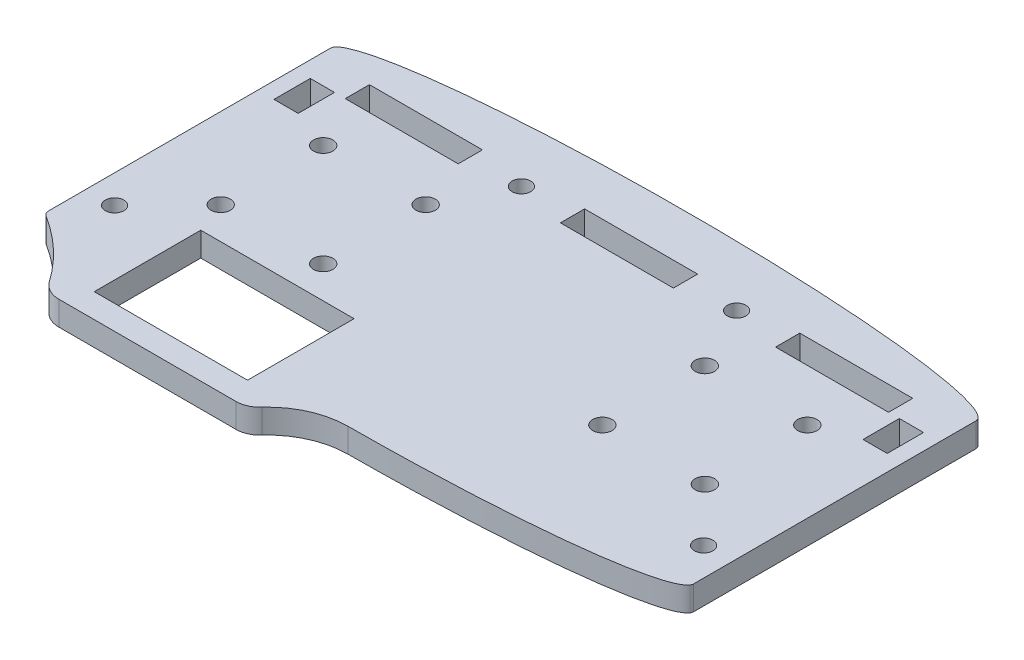
from build123d import *

# Parameters (mm, degrees)
SKETCH1_W           = 80
SKETCH1_H           = 35
BOSS_EXTRUDE1_DEPTH = 1.5
SKETCH2_R           = 1.15
SKETCH2_W           = 14
SKETCH2_H           = 3
CUT_EXTRUDE1_DEPTH  = 44.763569324
BOSS_EXTRUDE2_DEPTH = 3
SKETCH5_R           = 1.2
CUT_EXTRUDE2_DEPTH  = 46.749317077
SKETCH7_R           = 1.15
SKETCH7_W           = 3
SKETCH7_H           = 4.5
CUT_EXTRUDE3_DEPTH  = 46.749317077
BOSS_EXTRUDE3_DEPTH = 3
BOSS_EXTRUDE4_DEPTH = 3
CUT_EXTRUDE4_DEPTH  = 10
FILLET1_START       = -1.5
FILLET1_DEPTH       = 3
FILLET2_START       = -1.5
FILLET2_DEPTH       = 3
FILLET3_R           = 3


with BuildPart() as part:
    # Sketch1 → Boss-Extrude1 (new, symmetric)
    with BuildSketch(Plane(origin=(0, 0, 0), x_dir=(1, 0, 0), z_dir=(0, 1, 0))):
        Rectangle(SKETCH1_W, SKETCH1_H)
    extrude(amount=BOSS_EXTRUDE1_DEPTH, both=True)

    # Sketch2 → Cut-Extrude1 (cut, through all)
    with BuildSketch(Plane(origin=(0, 1.5, 0), x_dir=(1, 0, 0), z_dir=(0, 1, 0))):
        with Locations(Location((-13.333333333, 14.5, 0), (0, 0, 270))):
            Circle(SKETCH2_R)
        with Locations(Location((13.333333333, 14.5, 0), (0, 0, 270))):
            Circle(SKETCH2_R)
        with Locations((-26.666666667, 14.5)):
            Rectangle(SKETCH2_W, SKETCH2_H)
        with Locations((0, 14.5)):
            Rectangle(SKETCH2_W, SKETCH2_H)
        with Locations((26.666666667, 14.5)):
            Rectangle(SKETCH2_W, SKETCH2_H)
    extrude(amount=-CUT_EXTRUDE1_DEPTH, mode=Mode.SUBTRACT)

    # Sketch3 → Boss-Extrude2 (add)
    with BuildSketch(Plane(origin=(0, 1.5, 0), x_dir=(1, 0, 0), z_dir=(0, 1, 0))):
        with BuildLine():
            Line((40, 17.5), (-40, 17.5))
            add(Edge.make_bspline(
                [(40, 17.5), (40, 22), (0, 22), (-40, 22), (-40, 17.5)],
                knots=[3.141592654, 3.141592654, 3.141592654, 4.71238898, 4.71238898, 6.283185307, 6.283185307, 6.283185307], degree=2, weights=[1, 0.707106781, 1, 0.707106781, 1]))
        make_face()
    extrude(amount=-BOSS_EXTRUDE2_DEPTH)

    # Sketch5 → Cut-Extrude2 (cut, through all)
    with BuildSketch(Plane.XZ.offset(1.5)):
        with Locations(Location((17.3, -6.6, 0), (0, 0, 270))):
            Circle(SKETCH5_R)
        with Locations(Location((17.3, 6.1, 0), (0, 0, 270))):
            Circle(SKETCH5_R)
        with Locations(Location((30, 6.1, 0), (0, 0, 270))):
            Circle(SKETCH5_R)
        with Locations(Location((30, -6.6, 0), (0, 0, 270))):
            Circle(SKETCH5_R)
        with Locations(Location((-17.3, 6.1, 0), (0, 0, 270))):
            Circle(SKETCH5_R)
        with Locations(Location((-30, -6.6, 0), (0, 0, 270))):
            Circle(SKETCH5_R)
        with Locations(Location((-30, 6.1, 0), (0, 0, 270))):
            Circle(SKETCH5_R)
        with Locations(Location((-17.3, -6.6, 0), (0, 0, 270))):
            Circle(SKETCH5_R)
    extrude(amount=-CUT_EXTRUDE2_DEPTH, mode=Mode.SUBTRACT)

    # Sketch7 → Cut-Extrude3 (cut, through all)
    with BuildSketch(Plane.XZ.offset(1.5)):
        with Locations(Location((-36.5, 12.75, 0), (0, 0, 270))):
            Circle(SKETCH7_R)
        with Locations(Location((36.5, 12.75, 0), (0, 0, 270))):
            Circle(SKETCH7_R)
        with Locations((36.5, -10.75)):
            Rectangle(SKETCH7_W, SKETCH7_H)
        with Locations((-36.5, -10.75)):
            Rectangle(SKETCH7_W, SKETCH7_H)
    extrude(amount=-CUT_EXTRUDE3_DEPTH, mode=Mode.SUBTRACT)

    # Sketch8 → Boss-Extrude3 (add)
    with BuildSketch(Plane.XZ.offset(1.5)):
        with BuildLine():
            Line((-40, 17.5), (40, 17.5))
            add(Edge.make_bspline(
                [(40, 17.5), (40, 22), (0, 22), (-40, 22), (-40, 17.5)],
                knots=[0, 0, 0, 1.570796327, 1.570796327, 3.141592654, 3.141592654, 3.141592654], degree=2, weights=[1, 0.707106781, 1, 0.707106781, 1]))
        make_face()
    extrude(amount=-BOSS_EXTRUDE3_DEPTH)

    # Sketch10 → Boss-Extrude4 (add)
    with BuildSketch(Plane(origin=(0, 1.5, 0), x_dir=(1, 0, 0), z_dir=(0, 1, 0))):
        with BuildLine():
            add(Edge.make_bspline(
                [(-31.5, -20.273415933), (-30.097145276, -20.475072928), (-28.5, -20.657524495)],
                knots=[3.805646931, 3.805646931, 3.805646931, 3.920888088, 3.920888088, 3.920888088], degree=2, weights=[1, 0.989412299, 0.982106666]))
            Line((-31.5, -20.273415933), (-31.5, -26.273415933))
            Line((-31.5, -26.273415933), (-6.5, -26.273415933))
            Line((-6.5, -26.273415933), (-6.5, -21.940188446))
            add(Edge.make_bspline(
                [(-9.5, -21.871243923), (-8.01173666, -21.912179734), (-6.5, -21.940188446)],
                knots=[4.471327399, 4.471327399, 4.471327399, 4.549165177, 4.549165177, 4.549165177], degree=2, weights=[0.987194732, 0.992848708, 1]))
            Line((-9.5, -21.871243923), (-9.5, -23.273415933))
            Line((-9.5, -23.273415933), (-28.5, -23.273415933))
            Line((-28.5, -23.273415933), (-28.5, -20.657524495))
        make_face()
        with BuildLine():
            add(Edge.make_bspline(
                [(-28.5, -20.657524495), (-20.531503418, -21.567814066), (-9.5, -21.871243923)],
                knots=[3.920888088, 3.920888088, 3.920888088, 4.471327399, 4.471327399, 4.471327399], degree=2, weights=[0.982106666, 0.94721195, 0.987194732]))
            Line((-28.5, -20.657524495), (-28.5, -23.273415933))
            Line((-28.5, -23.273415933), (-9.5, -23.273415933))
            Line((-9.5, -23.273415933), (-9.5, -21.871243923))
        make_face()
    extrude(amount=-BOSS_EXTRUDE4_DEPTH)

    # Sketch10<3> → Cut-Extrude4 (cut)
    with BuildSketch(Plane(origin=(0, 1.5, 0), x_dir=(1, 0, 0), z_dir=(0, 1, 0))):
        with BuildLine():
            Line((-28.5, -10.073415933), (-28.5, -20.657524495))
            add(Edge.make_bspline(
                [(-28.5, -20.657524495), (-20.531503418, -21.567814066), (-9.5, -21.871243923)],
                knots=[3.920888088, 3.920888088, 3.920888088, 4.471327399, 4.471327399, 4.471327399], degree=2, weights=[0.982106666, 0.94721195, 0.987194732]))
            Line((-9.5, -21.871243923), (-9.5, -10.073415933))
            Line((-9.5, -10.073415933), (-28.5, -10.073415933))
        make_face()
        with BuildLine():
            add(Edge.make_bspline(
                [(-28.5, -20.657524495), (-20.531503418, -21.567814066), (-9.5, -21.871243923)],
                knots=[3.920888088, 3.920888088, 3.920888088, 4.471327399, 4.471327399, 4.471327399], degree=2, weights=[0.982106666, 0.94721195, 0.987194732]))
            Line((-28.5, -20.657524495), (-28.5, -23.273415933))
            Line((-28.5, -23.273415933), (-9.5, -23.273415933))
            Line((-9.5, -23.273415933), (-9.5, -21.871243923))
        make_face()
    extrude(amount=-CUT_EXTRUDE4_DEPTH, mode=Mode.SUBTRACT)

    # Fillet1: read off the stored shape, not the designer's step
    # Fillet1 outline → Fillet1 (add)
    with BuildSketch(Plane(origin=(0, 0, 0), x_dir=(1, 0, 0), z_dir=(0, 1, 0)).offset(FILLET1_START)):
        with BuildLine():
            add(Edge.make_bspline(
                [(-31.5, -20.273415933), (-37.645057381, -19.390078703), (-39.385725394, -18.285606399)],
                knots=[2.477538376, 2.477538376, 2.477538376, 2.964990982, 2.964990982, 2.964990982], degree=2, weights=[1, 0.95990848, 0.978675751]))
            ThreePointArc((-39.385725394, -18.285606399), (-34.988771161, -21.831222917), (-31.5, -26.273415933))
            Line((-31.5, -26.273415933), (-31.5, -20.273415933))
        make_face()
    extrude(amount=FILLET1_DEPTH)

    # Fillet2: read off the stored shape, not the designer's step
    # Fillet2 outline → Fillet2 (add)
    with BuildSketch(Plane(origin=(0, 0, 0), x_dir=(1, 0, 0), z_dir=(0, 1, 0)).offset(FILLET2_START)):
        with BuildLine():
            Line((-6.5, -21.940188446), (-6.5, -26.273415933))
            ThreePointArc((-6.5, -26.273415933), (-2.944519169, -23.140428139), (1.654142088, -21.996150592))
            add(Edge.make_bspline(
                [(1.654142088, -21.996150592), (-2.448460848, -22.015253368), (-6.5, -21.940188446)],
                knots=[1.511133725, 1.511133725, 1.511133725, 1.73402013, 1.73402013, 1.73402013], degree=2, weights=[0.920941451, 0.954640309, 1]))
        make_face()
    extrude(amount=FILLET2_DEPTH)

    # Fillet3
    fillet3_edges = [part.edges().sort_by_distance(p)[0] for p in [
        (-6.5, 0, 26.273415933),
        (-31.5, 0, 26.273415933),
    ]]
    fillet(fillet3_edges, radius=FILLET3_R)


solid = part.part
